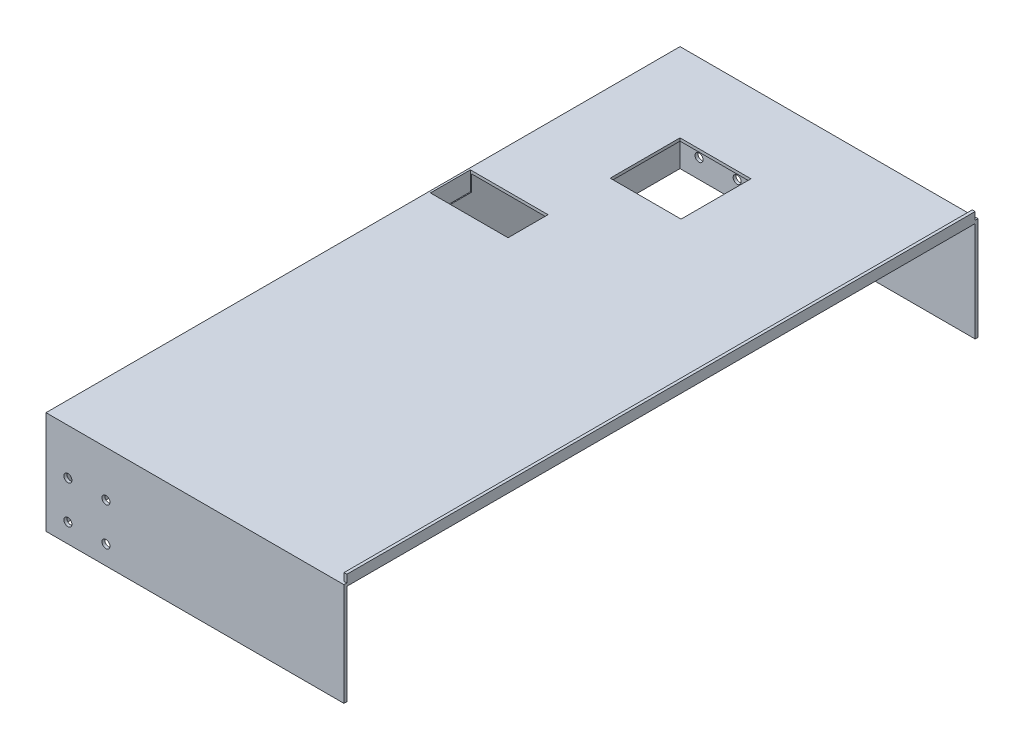
from build123d import *

# Parameters (mm, degrees)
BOSS_EXTRUDE4_DEPTH  = 1.5
SKETCH5_W            = 155
SKETCH5_H            = 54
BOSS_EXTRUDE5_DEPTH  = 1.5
SKETCH8_W            = 1.5
SKETCH8_H            = 330
BOSS_EXTRUDE14_DEPTH = 4
SKETCH7_W            = 155
SKETCH7_H            = 54
BOSS_EXTRUDE18_DEPTH = 1.5
SKETCH9_W            = 333
SKETCH9_H            = 54
BOSS_EXTRUDE19_DEPTH = 1.5
SKETCH10_R           = 2.1
CUT_EXTRUDE1_DEPTH   = 10
CUT_EXTRUDE2_START   = -10
SKETCH17_R           = 2.1
CUT_EXTRUDE2_DEPTH   = 10
SKETCH16_R           = 2.1
CUT_EXTRUDE3_DEPTH   = 10
CUT_EXTRUDE4_START   = -10
SKETCH11_R           = 2.1
CUT_EXTRUDE4_DEPTH   = 10
SKETCH12_R           = 2.1
CUT_EXTRUDE5_DEPTH   = 10
SKETCH13_R           = 2.1
CUT_EXTRUDE6_DEPTH   = 10
CUT_EXTRUDE7_START   = -10
SKETCH14_R           = 2.1
CUT_EXTRUDE7_DEPTH   = 10
CUT_EXTRUDE8_START   = -10
SKETCH15_R           = 2.1
CUT_EXTRUDE8_DEPTH   = 10
SKETCH18_W           = 40.776716255
SKETCH18_H           = 21.003646254
CUT_EXTRUDE9_DEPTH   = 10
SKETCH21_W           = 37.24685685
SKETCH21_H           = 36.694897388
CUT_EXTRUDE12_DEPTH  = 10


with BuildPart() as part:
    # Sketch4 → Boss-Extrude4 (new body)
    with BuildSketch(Plane(origin=(0, 0, 0), x_dir=(1, 0, 0), z_dir=(0, 1, 0))):
        Polygon((179.47837592, 330), (334.47837592, 330), (334.47837592, 0), (179.47837592, 0), (179.47837592, 200), (179.47837592, 265), align=None)
    extrude(amount=BOSS_EXTRUDE4_DEPTH)

    # Sketch5 → Boss-Extrude5 (add)
    with BuildSketch(Plane.XY):
        with Locations((256.97837592, -25.5)):
            Rectangle(SKETCH5_W, SKETCH5_H)
    extrude(amount=BOSS_EXTRUDE5_DEPTH)

    # Sketch8 → Boss-Extrude14 (add)
    with BuildSketch(Plane(origin=(0, 1.5, 0), x_dir=(1, 0, 0), z_dir=(0, 1, 0))):
        with Locations((333.72837592, 165)):
            Rectangle(SKETCH8_W, SKETCH8_H)
    extrude(amount=BOSS_EXTRUDE14_DEPTH)

    # Sketch7 → Boss-Extrude18 (add)
    with BuildSketch(Plane(origin=(0, 0, -330), x_dir=(-1, 0, 0), z_dir=(0, 0, -1))):
        with Locations((-256.97837592, -25.5)):
            Rectangle(SKETCH7_W, SKETCH7_H)
    extrude(amount=BOSS_EXTRUDE18_DEPTH)

    # Sketch9 → Boss-Extrude19 (add)
    with BuildSketch(Plane.ZY.offset(-179.47837592)):
        with Locations((-165, -25.5)):
            Rectangle(SKETCH9_W, SKETCH9_H)
    extrude(amount=BOSS_EXTRUDE19_DEPTH)

    # Sketch10 → Cut-Extrude1 (cut)
    with BuildSketch(Plane(origin=(0, 0, -331.5), x_dir=(-1, 0, 0), z_dir=(0, 0, -1))):
        with Locations((-209.47837592, -42.5)):
            Circle(SKETCH10_R)
    extrude(amount=-CUT_EXTRUDE1_DEPTH, mode=Mode.SUBTRACT)

    # Sketch17 → Cut-Extrude2 (cut)
    with BuildSketch(Plane.XY.offset(1.5).offset(CUT_EXTRUDE2_START)):
        with Locations((209.47837592, -42.5)):
            Circle(SKETCH17_R)
    extrude(amount=CUT_EXTRUDE2_DEPTH, mode=Mode.SUBTRACT)

    # Sketch16 → Cut-Extrude3 (cut)
    with BuildSketch(Plane.XY.offset(1.5)):
        with Locations((189.47837592, -42.5)):
            Circle(SKETCH16_R)
    extrude(amount=-CUT_EXTRUDE3_DEPTH, mode=Mode.SUBTRACT)

    # Sketch11 → Cut-Extrude4 (cut)
    with BuildSketch(Plane(origin=(0, 0, -331.5), x_dir=(-1, 0, 0), z_dir=(0, 0, -1)).offset(CUT_EXTRUDE4_START)):
        with Locations((-189.47837592, -42.5)):
            Circle(SKETCH11_R)
    extrude(amount=CUT_EXTRUDE4_DEPTH, mode=Mode.SUBTRACT)

    # Sketch12 → Cut-Extrude5 (cut)
    with BuildSketch(Plane(origin=(0, 0, -331.5), x_dir=(-1, 0, 0), z_dir=(0, 0, -1))):
        with Locations((-189.47837592, -22.5)):
            Circle(SKETCH12_R)
    extrude(amount=-CUT_EXTRUDE5_DEPTH, mode=Mode.SUBTRACT)

    # Sketch13 → Cut-Extrude6 (cut)
    with BuildSketch(Plane(origin=(0, 0, -331.5), x_dir=(-1, 0, 0), z_dir=(0, 0, -1))):
        with Locations((-209.47837592, -22.5)):
            Circle(SKETCH13_R)
    extrude(amount=-CUT_EXTRUDE6_DEPTH, mode=Mode.SUBTRACT)

    # Sketch14 → Cut-Extrude7 (cut)
    with BuildSketch(Plane.XY.offset(1.5).offset(CUT_EXTRUDE7_START)):
        with Locations((189.47837592, -22.5)):
            Circle(SKETCH14_R)
    extrude(amount=CUT_EXTRUDE7_DEPTH, mode=Mode.SUBTRACT)

    # Sketch15 → Cut-Extrude8 (cut)
    with BuildSketch(Plane.XY.offset(1.5).offset(CUT_EXTRUDE8_START)):
        with Locations((209.47837592, -22.5)):
            Circle(SKETCH15_R)
    extrude(amount=CUT_EXTRUDE8_DEPTH, mode=Mode.SUBTRACT)

    # Sketch18 → Cut-Extrude9 (cut)
    with BuildSketch(Plane(origin=(0, 1.5, 0), x_dir=(1, 0, 0), z_dir=(0, 1, 0))):
        with Locations((199.375823154, 209.882956498)):
            Rectangle(SKETCH18_W, SKETCH18_H)
    extrude(amount=-CUT_EXTRUDE9_DEPTH, mode=Mode.SUBTRACT)

    # Sketch21 → Cut-Extrude12 (cut)
    with BuildSketch(Plane(origin=(0, 1.5, 0), x_dir=(1, 0, 0), z_dir=(0, 1, 0))):
        with Locations((238.101804345, 271.652551306)):
            Rectangle(SKETCH21_W, SKETCH21_H)
    extrude(amount=-CUT_EXTRUDE12_DEPTH, mode=Mode.SUBTRACT)


solid = part.part
